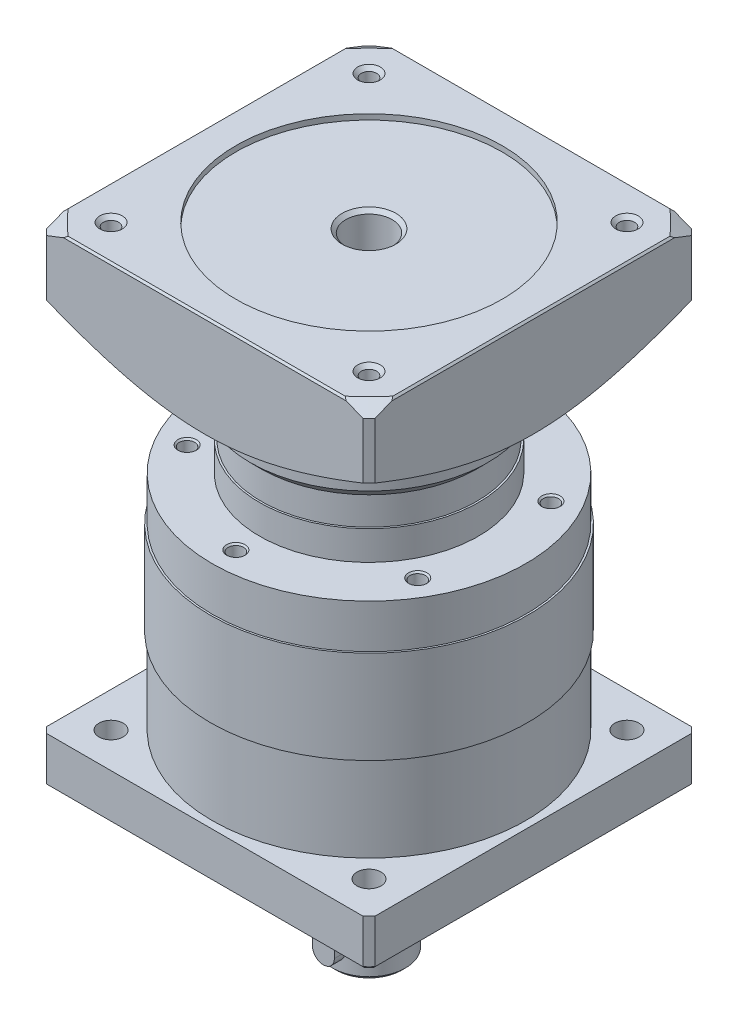
from build123d import *

# Parameters (mm, degrees)
SKETCH_2_OUTSIDE_W                   = 176.468
SKETCH_2_OUTSIDE_H                   = 176.468
SKETCH_2_OUTSIDE_W_2                 = 90
SKETCH_2_OUTSIDE_H_2                 = 90
CUT_EXTRUDE_1_DEPTH                  = 160.69189084
SKETCH_3_R                           = 3.3
CUT_EXTRUDE_2_DEPTH                  = 34.5
CHAMFER_1_SIZE                       = 0.3
CHAMFER_2_SIZE                       = 0.5
CHAMFER_3_SIZE                       = 0.5
SKETCH_8_OUTSIDE_W                   = 134.956
SKETCH_8_OUTSIDE_H                   = 134.956
SKETCH_8_OUTSIDE_R                   = 43
CUT_EXTRUDE_6_DEPTH                  = 23.5
EXTRUDE_1_REACH                      = 198.834
EXTRUDE_1_END_RADIUS                 = 10
EXTRUDE_START                        = 12.5
SKETCH_10_R                          = 2.1
CUT_EXTRUDE_8_DEPTH                  = 20
CHAMFER_4_SIZE                       = 1
PATTERN_CIRCULAR_1_COUNT             = 4
CHAMFER_4_OF_PATTERN_CIRCULAR_1_SIZE = 1
CHAMFER_5_SIZE                       = 3
M5X0_81_D                            = 4.2
M5X0_81_DEPTH                        = 14
M5X0_81_CSINK_D                      = 5.05
M5X0_81_CSINK_ANGLE                  = 90
M5X0_81_TIP                          = 1.2618073
M6X1_01_D                            = 5
M6X1_01_DEPTH                        = 21
M6X1_01_CSINK_D                      = 8
M6X1_01_CSINK_ANGLE                  = 90
M6X1_01_TIP                          = 1.502151548


with BuildPart() as part:
    # Эскиз1 → Повернуть1 (revolve)
    with BuildSketch(Plane.XY, mode=Mode.PRIVATE) as revolve_1_sk:
        Polygon((-2.1, 0), (-9, 0), (-10, 1), (-10, 36), (-16, 36), (-16, 37), (-39, 37), (-40, 38), (-40, 40), (-62, 40), (-62.5, 40.5), (-62.5, 76), (-43.5, 76), (-43.5, 101.5), (-43, 101.5), (-43, 113.5), (-30, 113.5), (-30, 121.5), (-29.5, 121.5), (-29.5, 129.2), (-32.5, 129.2), (-32.5, 138), (-62.5, 138), (-62.5, 170.690598923), (-58.5, 173), (-36.5, 173), (-36.5, 171.5), (-7.35, 171.5), (-6.35, 170.5), (-6.35, 143), (0, 139.333825791), (0, 17.212435565), (-2.1, 16), align=None)
    revolve(revolve_1_sk.sketch.rotate(Axis((0, 0, 0), (0, 1, 0)), 270), axis=Axis((0, 0, 0), (0, 1, 0)))

    # Эскиз2 outside → Вырез-Вытянуть1 (cut, through all)
    with BuildSketch(Plane.XZ.offset(-40)):
        Rectangle(SKETCH_2_OUTSIDE_W, SKETCH_2_OUTSIDE_H)
        Rectangle(SKETCH_2_OUTSIDE_W_2, SKETCH_2_OUTSIDE_H_2, mode=Mode.SUBTRACT)
    extrude(amount=-CUT_EXTRUDE_1_DEPTH, mode=Mode.SUBTRACT)

    # Эскиз3 → Вырез-Вытянуть2 (cut)
    with BuildSketch(Plane.XZ.offset(-40)):
        with Locations(Location((-35.355339059, 35.355339059, 0), (0, 0, 270))):
            Circle(SKETCH_3_R)
        with Locations(Location((35.355339059, 35.355339059, 0), (0, 0, 270))):
            Circle(SKETCH_3_R)
        with Locations(Location((35.355339059, -35.355339059, 0), (0, 0, 270))):
            Circle(SKETCH_3_R)
        with Locations(Location((-35.355339059, -35.355339059, 0), (0, 0, 270))):
            Circle(SKETCH_3_R)
    extrude(amount=-CUT_EXTRUDE_2_DEPTH, mode=Mode.SUBTRACT)

    # Фаска1
    chamfer_1_edges = [part.edges().sort_by_distance(p)[0] for p in [
        (-35.355339059, 40, 38.655339059),
        (35.355339059, 40, 38.655339059),
        (35.355339059, 40, -32.055339059),
        (-35.355339059, 40, -32.055339059),
    ]]
    chamfer(chamfer_1_edges, length=CHAMFER_1_SIZE)

    # Фаска2
    chamfer_2_edges = [part.edges().sort_by_distance(p)[0] for p in [
        (-45, 40, 0),
        (0, 40, -45),
        (45, 40, 0),
        (0, 40, 45),
    ]]
    chamfer(chamfer_2_edges, length=CHAMFER_2_SIZE)

    # Фаска3
    chamfer_3_edges = [part.edges().sort_by_distance(p)[0] for p in [
        (0, 173, -45),
        (-45, 173, 0),
        (0, 173, 45),
        (45, 173, 0),
    ]]
    chamfer(chamfer_3_edges, length=CHAMFER_3_SIZE)

    # Эскиз8 outside → Вырез-Вытянуть6 (cut)
    with BuildSketch(Plane(origin=(0, 76, 0), x_dir=(1, 0, 0), z_dir=(0, 1, 0))):
        Rectangle(SKETCH_8_OUTSIDE_W, SKETCH_8_OUTSIDE_H)
        with Locations(Location((0, 0, 0), (0, 0, 90))):
            Circle(SKETCH_8_OUTSIDE_R, mode=Mode.SUBTRACT)
    extrude(amount=-CUT_EXTRUDE_6_DEPTH, mode=Mode.SUBTRACT)

    # Вытянуть1: up to this cylinder (the profile starts outside it)
    extrude_1_end = Plane(origin=(0, 18, 0), z_dir=(0, -1, 0)) * Cylinder(EXTRUDE_1_END_RADIUS, 418.668, mode=Mode.PRIVATE)
    # Эскиз5 → Вытянуть1 (add, up to the surface)
    with BuildSketch(Plane.XY.offset(EXTRUDE_START), mode=Mode.PRIVATE) as extrude_1_sk1:
        with BuildLine():
            Line((-3, 30), (-3, 6))
            ThreePointArc((-3, 6), (0, 3), (3, 6))
            Line((3, 6), (3, 30))
            ThreePointArc((3, 30), (0, 33), (-3, 30))
        make_face()
    extrude_1_tool1 = extrude(extrude_1_sk1.sketch, amount=-EXTRUDE_1_REACH, mode=Mode.PRIVATE) - extrude_1_end
    add(extrude_1_tool1.solids().sort_by_distance((0, 18, 12.5))[0])

    # Эскиз10 → Вырез-Вытянуть8 (cut)
    with BuildSketch(Plane(origin=(0, 173, 0), x_dir=(1, 0, 0), z_dir=(0, 1, 0))):
        with Locations(Location((-35.355339059, 35.355339059, 0), (0, 0, 270))):
            Circle(SKETCH_10_R)
    cut_extrude_8 = extrude(amount=-CUT_EXTRUDE_8_DEPTH, mode=Mode.SUBTRACT)

    # Фаска4
    chamfer_4_edges = [part.edges().sort_by_distance(p)[0] for p in [
        (-35.355339059, 173, -37.455339059),
    ]]
    chamfer(chamfer_4_edges, length=CHAMFER_4_SIZE)

    # Круговой массив1: Вырез-Вытянуть8 ×4 about axis
    pattern_circular_1_axis = Axis((0, 0, 0), (0, 1, 0))
    for i in range(1, PATTERN_CIRCULAR_1_COUNT):
        add(cut_extrude_8.rotate(pattern_circular_1_axis, i * 360 / PATTERN_CIRCULAR_1_COUNT), mode=Mode.SUBTRACT)

    # Фаска4 of Круговой массив1
    chamfer_4_of_pattern_circular_1_edges = [part.edges().sort_by_distance(p)[0] for p in [
        (-37.455339059, 173, 35.355339059),
        (35.355339059, 173, 37.455339059),
        (37.455339059, 173, -35.355339059),
    ]]
    chamfer(chamfer_4_of_pattern_circular_1_edges, length=CHAMFER_4_OF_PATTERN_CIRCULAR_1_SIZE)

    # Фаска5
    chamfer_5_edges = [part.edges().sort_by_distance(p)[0] for p in [
        (0, 129.2, 32.5),
    ]]
    chamfer(chamfer_5_edges, length=CHAMFER_5_SIZE - 0.0001)  # a hair under: the kernel refuses the full size

    # Эскиз12 → Вырез-Повернуть1 (revolve, cut)
    with BuildSketch(Plane(origin=(0, 0, 0), x_dir=(-0.7071067811865487, 0, -0.7071067811865465), z_dir=(0.7071067811865465, 0, -0.7071067811865487)), mode=Mode.PRIVATE) as cut_revolve_1_sk:
        Polygon((-32.5, 138), (-62.989415519, 155.603072258), (-62.989415519, 138), align=None)
    revolve(cut_revolve_1_sk.sketch.rotate(Axis((0, 0, 0), (0, -1, 0)), 45), axis=Axis((0, 0, 0), (0, -1, 0)), mode=Mode.SUBTRACT)

    # Отверстие обработанное метчиком M5x0.81
    with Locations(Plane(origin=(0, 113.5, 36.5), x_dir=(0, 0, 1), z_dir=(0, 1, 0))):
        with Locations((0, 0), (-18.25, 31.609927238), (-54.75, 31.609927238), (-73, 0), (-54.75, -31.609927238), (-18.25, -31.609927238)):
            CounterSinkHole(M5X0_81_D / 2, M5X0_81_CSINK_D / 2, depth=M5X0_81_DEPTH, counter_sink_angle=M5X0_81_CSINK_ANGLE)
            with Locations((0, 0, -(M5X0_81_DEPTH + M5X0_81_TIP / 2))):  # 118° drill point
                Cone(0, M5X0_81_D / 2, M5X0_81_TIP, mode=Mode.SUBTRACT)

    # Отверстие обработанное метчиком M6x1.01
    with Locations(Plane.XZ):
        with Locations((0, 0)):
            CounterSinkHole(M6X1_01_D / 2, M6X1_01_CSINK_D / 2, depth=M6X1_01_DEPTH, counter_sink_angle=M6X1_01_CSINK_ANGLE)
            with Locations((0, 0, -(M6X1_01_DEPTH + M6X1_01_TIP / 2))):  # 118° drill point
                Cone(0, M6X1_01_D / 2, M6X1_01_TIP, mode=Mode.SUBTRACT)


solid = part.part
